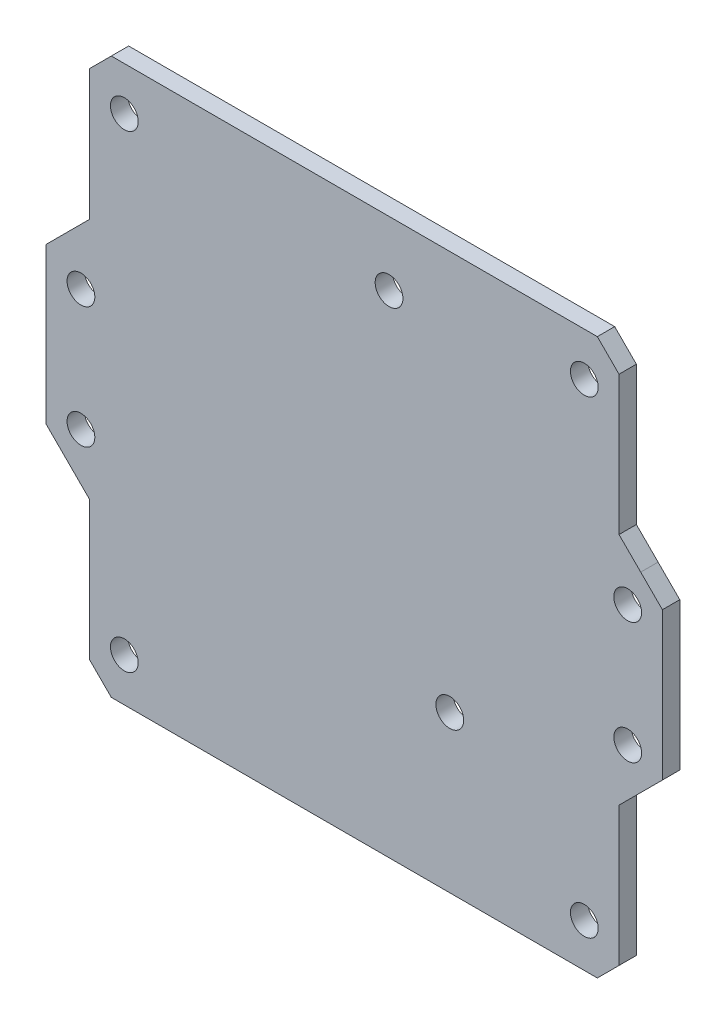
from build123d import *

# Parameters (mm, degrees)
SKETCH_1_W      = 38
SKETCH_1_H      = 54
SKETCH_1_R      = 1.6
EXTRUDE_1_DEPTH = 2
SKETCH_4_R      = 1.6
EXTRUDE_2_DEPTH = 2
CHAMFER_1_SIZE  = 2.5


with BuildPart() as part:
    # 草图1 → 凸台-拉伸1 (new body)
    with BuildSketch(Plane.XY):
        with Locations((-11, 14)):
            Rectangle(SKETCH_1_W, SKETCH_1_H)
        Circle(SKETCH_1_R, mode=Mode.SUBTRACT)
        with Locations((-7, 38.6)):
            Circle(SKETCH_1_R, mode=Mode.SUBTRACT)
    extrude(amount=EXTRUDE_1_DEPTH)

    # 草图4 → 凸台-拉伸2 (add)
    with BuildSketch(Plane.XY):
        Polygon((-33.880035193, 46), (19.5, 46), (19.5, 25), (24.5, 25), (24.5, 3), (19.5, 3), (19.5, -18), (-41.5, -18), (-41.5, 2.119651453), (-41.5, 3), (-46.5, 3), (-46.5, 25.960072655), (-41.5, 25.960072655), (-41.5, 46), align=None)
        with Locations((-37.5, 41)):
            Circle(SKETCH_4_R, mode=Mode.SUBTRACT)
        with Locations((15.5, -13)):
            Circle(SKETCH_4_R, mode=Mode.SUBTRACT)
        with Locations((-37.5, -13)):
            Circle(SKETCH_4_R, mode=Mode.SUBTRACT)
        with Locations((15.5, 41)):
            Circle(SKETCH_4_R, mode=Mode.SUBTRACT)
        with Locations((-42.5, 21)):
            Circle(SKETCH_4_R, mode=Mode.SUBTRACT)
        with Locations((20.5, 7)):
            Circle(SKETCH_4_R, mode=Mode.SUBTRACT)
        with Locations((-42.5, 7)):
            Circle(SKETCH_4_R, mode=Mode.SUBTRACT)
        with Locations((20.5, 21)):
            Circle(SKETCH_4_R, mode=Mode.SUBTRACT)
        with Locations((-7, 38.6)):
            Circle(SKETCH_4_R, mode=Mode.SUBTRACT)
        Circle(SKETCH_4_R, mode=Mode.SUBTRACT)
    extrude(amount=EXTRUDE_2_DEPTH)

    # Chamfer 1
    chamfer_1_edges = [part.edges().sort_by_distance(p)[0] for p in [
        (19.5, -18, 1),
        (19.5, 3, 1),
        (24.5, 3, 1),
        (24.5, 25, 1),
        (19.5, 25, 1),
        (19.5, 46, 1),
        (-41.5, -18, 1),
        (-41.5, 3, 1),
        (-46.5, 3, 1),
        (-41.5, 25.960072655, 1),
        (-46.5, 25.960072655, 1),
        (-41.5, 46, 1),
    ]]
    chamfer(chamfer_1_edges, length=CHAMFER_1_SIZE - 0.0001)  # a hair under: the kernel refuses the full size


solid = part.part
